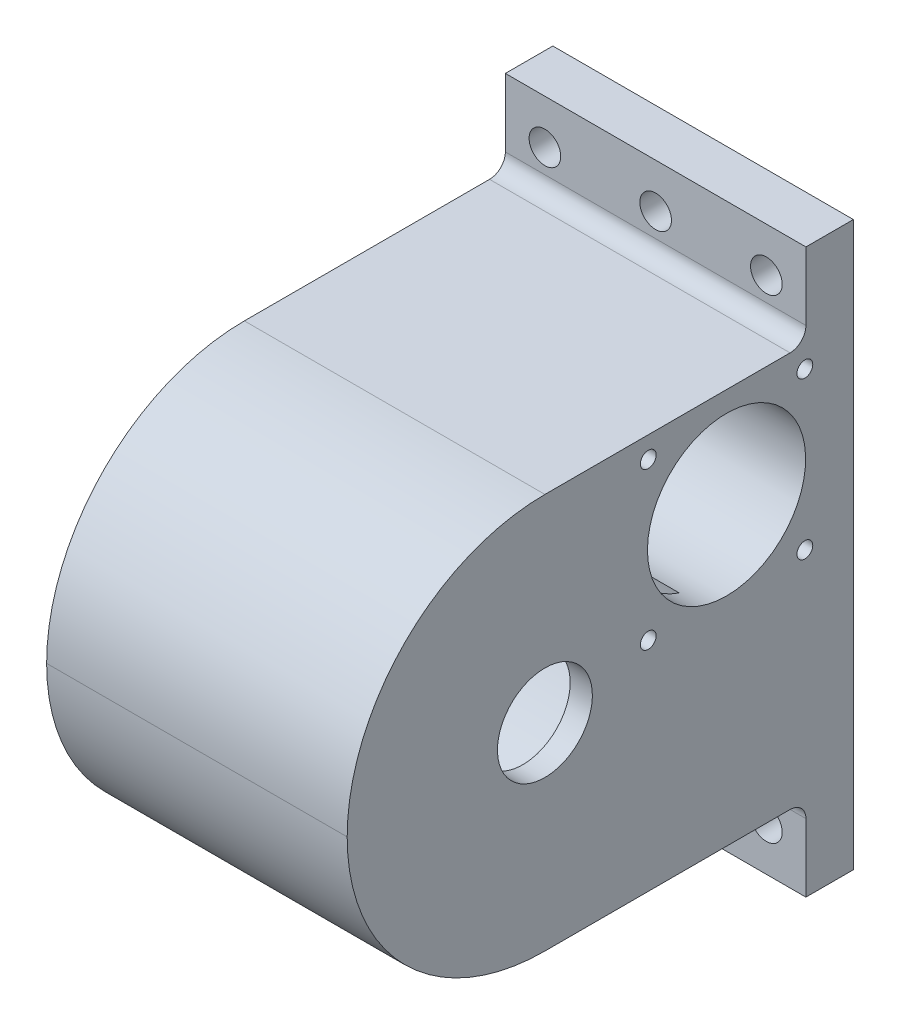
from build123d import *

# Parameters (mm, degrees)
SKETCH_1_W          = 95
SKETCH_1_H          = 178
EXTRUDE_1_DEPTH     = 160
SKETCH_2_W          = 145
SKETCH_2_H          = 26.5
SKETCH_2_W_2        = 185
CUT_EXTRUDE_1_DEPTH = 258.50533975
FILLET_1_R          = 62.5
SKETCH_3_R          = 50
CUT_EXTRUDE_2_DEPTH = 230
SKETCH_5_R          = 50
SKETCH_5_R_2        = 15
EXTRUDE_3_DEPTH     = 7
SKETCH_6_R          = 25
CUT_EXTRUDE_3_DEPTH = 40
SKETCH_11_R         = 2.5
CUT_EXTRUDE_4_DEPTH = 15
CUT_EXTRUDE_5_DEPTH = 40
SKETCH_13_R         = 3
CUT_EXTRUDE_6_DEPTH = 20
SKETCH_14_R         = 5
CUT_EXTRUDE_7_DEPTH = 40
FILLET_2_R          = 5


with BuildPart() as part:
    # 草图1 → 拉伸1 (new body)
    with BuildSketch(Plane.XY):
        with Locations((47.5, -89)):
            Rectangle(SKETCH_1_W, SKETCH_1_H)
    extrude(amount=EXTRUDE_1_DEPTH)

    # 草图2 → 切除-拉伸1 (cut, through all)
    with BuildSketch(Plane(origin=(95, 0, 0), x_dir=(0, 0, -1), z_dir=(1, 0, 0))):
        with Locations((-87.5, -164.75)):
            Rectangle(SKETCH_2_W, SKETCH_2_H)
        with Locations((-107.5, -13.25)):
            Rectangle(SKETCH_2_W_2, SKETCH_2_H)
    extrude(amount=-CUT_EXTRUDE_1_DEPTH, mode=Mode.SUBTRACT)

    # 圆角1
    fillet_1_edges = [part.edges().sort_by_distance(p)[0] for p in [
        (47.5, -26.5, 160),
        (47.5, -151.5, 160),
    ]]
    fillet(fillet_1_edges, radius=FILLET_1_R - 0.0001)  # a hair under: the kernel refuses the full size

    # 草图3 → 切除-拉伸2 (cut)
    with BuildSketch(Plane(origin=(95, 0, 0), x_dir=(0, 0, -1), z_dir=(1, 0, 0))):
        with Locations(Location((-97.5, -89, 0), (0, 0, 90))):
            Circle(SKETCH_3_R)
    extrude(amount=-CUT_EXTRUDE_2_DEPTH, mode=Mode.SUBTRACT)

    # 草图5 → 拉伸3 (add)
    with BuildSketch(Plane(origin=(95, 0, 0), x_dir=(0, 0, -1), z_dir=(1, 0, 0))):
        with Locations(Location((-97.5, -89, 0), (0, 0, 90))):
            Circle(SKETCH_5_R)
        with Locations(Location((-97.5, -89, 0), (0, 0, 90))):
            Circle(SKETCH_5_R_2, mode=Mode.SUBTRACT)
    extrude(amount=-EXTRUDE_3_DEPTH)

    # 草图6 → 切除-拉伸3 (cut)
    with BuildSketch(Plane(origin=(95, 0, 0), x_dir=(0, 0, -1), z_dir=(1, 0, 0))):
        with Locations(Location((-40.084300927, -58, 0), (0, 0, 165.276076349))):
            Circle(SKETCH_6_R)
    extrude(amount=-CUT_EXTRUDE_3_DEPTH, mode=Mode.SUBTRACT)

    # 草图11 → 切除-拉伸4 (cut)
    with BuildSketch(Plane(origin=(95, 0, 0), x_dir=(0, 0, -1), z_dir=(1, 0, 0))):
        with Locations(Location((-64.833038269, -82.748737342, 0), (0, 0, 90))):
            Circle(SKETCH_11_R)
        with Locations(Location((-64.833038269, -33.251262658, 0), (0, 0, 270))):
            Circle(SKETCH_11_R)
        with Locations(Location((-15.335563586, -33.251262658, 0), (0, 0, 270))):
            Circle(SKETCH_11_R)
        with Locations(Location((-15.335563586, -82.748737342, 0), (0, 0, 270))):
            Circle(SKETCH_11_R)
    extrude(amount=-CUT_EXTRUDE_4_DEPTH, mode=Mode.SUBTRACT)

    # 草图12 → 切除-拉伸5 (cut)
    with BuildSketch(Plane(origin=(0, 0, 0), x_dir=(-1, 0, 0), z_dir=(0, 0, -1))):
        Polygon((-45, -39), (-20, -39), (-20, -139), (-45, -139), (-75, -139), (-75, -89), (-45, -89), align=None)
    extrude(amount=-CUT_EXTRUDE_5_DEPTH, mode=Mode.SUBTRACT)

    # 草图13 → 切除-拉伸6 (cut)
    with BuildSketch(Plane.ZY):
        with Locations(Location((153.5, -89, 0), (0, 0, 270))):
            Circle(SKETCH_13_R)
        with Locations(Location((142.804951685, -121.915974128, 0), (0, 0, 270))):
            Circle(SKETCH_13_R)
        with Locations(Location((114.804951685, -142.259164913, 0), (0, 0, 270))):
            Circle(SKETCH_13_R)
        with Locations(Location((80.195048315, -142.259164913, 0), (0, 0, 270))):
            Circle(SKETCH_13_R)
        with Locations(Location((52.195048315, -121.915974128, 0), (0, 0, 270))):
            Circle(SKETCH_13_R)
        with Locations(Location((41.5, -89, 0), (0, 0, 270))):
            Circle(SKETCH_13_R)
        with Locations(Location((52.195048315, -56.084025872, 0), (0, 0, 270))):
            Circle(SKETCH_13_R)
        with Locations(Location((80.195048315, -35.740835087, 0), (0, 0, 270))):
            Circle(SKETCH_13_R)
        with Locations(Location((114.804951685, -35.740835087, 0), (0, 0, 270))):
            Circle(SKETCH_13_R)
        with Locations(Location((142.804951685, -56.084025872, 0), (0, 0, 270))):
            Circle(SKETCH_13_R)
    extrude(amount=-CUT_EXTRUDE_6_DEPTH, mode=Mode.SUBTRACT)

    # 草图14 → 切除-拉伸7 (cut)
    with BuildSketch(Plane.XY.offset(15)):
        with Locations((12.5, -164)):
            Circle(SKETCH_14_R)
        with Locations((47.5, -164)):
            Circle(SKETCH_14_R)
        with Locations((82.5, -164)):
            Circle(SKETCH_14_R)
        with Locations((12.5, -14)):
            Circle(SKETCH_14_R)
        with Locations((47.5, -14)):
            Circle(SKETCH_14_R)
        with Locations((82.5, -14)):
            Circle(SKETCH_14_R)
    extrude(amount=-CUT_EXTRUDE_7_DEPTH, mode=Mode.SUBTRACT)

    # 圆角2
    fillet_2_edges = [part.edges().sort_by_distance(p)[0] for p in [
        (47.5, -151.5, 15),
        (47.5, -26.5, 15),
    ]]
    fillet(fillet_2_edges, radius=FILLET_2_R)


solid = part.part
